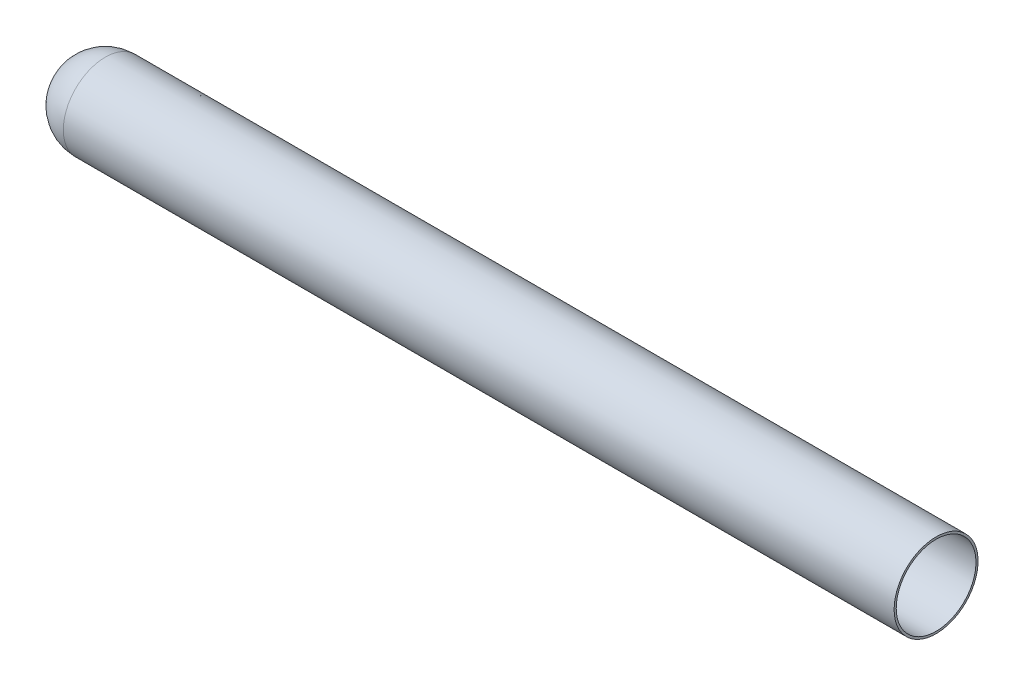
from build123d import *


with BuildPart() as part:
    # rootSketch → Revolve1 (revolve)
    with BuildSketch(Plane(origin=(0, 0, 0), x_dir=(1, 0, 0), z_dir=(0, 1, 0))):
        with BuildLine():
            Line((31.75, -31.75), (660, -31.75))
            Line((660, -31.75), (660, -30.1498))
            Line((660, -30.1498), (660, 0))
            Line((660, 0), (1.6002, 0))
            Line((1.6002, 0), (0, 0))
            ThreePointArc((0, 0), (9.299359697, -22.450640303), (31.75, -31.75))
        make_face()
    revolve(axis=Axis((0, 0, 0), (1, 0, 0)))

    # Sketch1 → Cut-Revolve1 (revolve, cut)
    with BuildSketch(Plane(origin=(0, 0, 0), x_dir=(1, 0, 0), z_dir=(0, 1, 0))):
        with BuildLine():
            Line((660, 0), (660, -30.1498))
            Line((660, -30.1498), (31.75, -30.1498))
            ThreePointArc((31.75, -30.1498), (10.430871969, -21.319128031), (1.6002, 0))
            Line((1.6002, 0), (660, 0))
        make_face()
    revolve(axis=Axis((1.6002, 0, 0), (1, 0, 0)), mode=Mode.SUBTRACT)


solid = part.part
